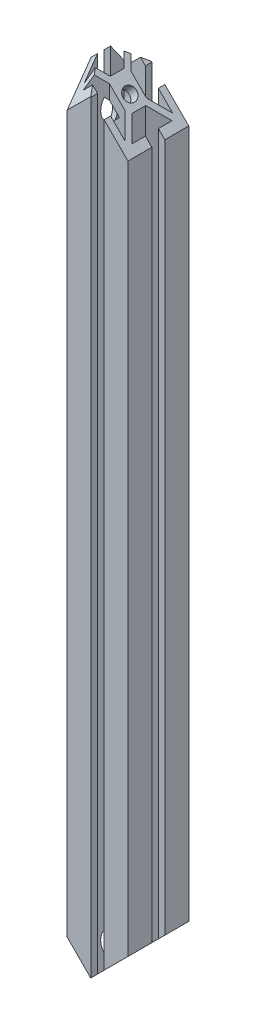
from build123d import *

# Parameters (mm, degrees)
EXTRUDE1_DEPTH       = 508
EXTRUDE2_DEPTH       = 457.2
SKETCH6_R            = 4.1656
EXTRUDE5_DEPTH       = 500.656640854
SKETCH8_R            = 9.525
EXTRUDE7_DEPTH       = 44.45
EXTRUDE8_DEPTH       = 374.167192757
MIRROR7_COPY_1_DEPTH = 374.167192757


# Read off the part's stored shape, not the designer's step: 1515<1>
with BuildPart() as part:
    # Sketch1<2> → Extrude1 (new body)
    with BuildSketch(Plane(origin=(0, 0, 0), x_dir=(1, 0, 0), z_dir=(0, 1, 0))):
        Polygon((-6.7564, 4.364749804), (-6.7564, -4.364749804), (-14.986, -12.594349804), (-14.986, -4.064), (-19.05, -4.064), (-19.05, -19.05), (-4.064, -19.05), (-4.064, -14.986), (-13.067127258, -14.986), (-4.837527258, -6.7564), (4.837527258, -6.7564), (13.067127258, -14.986), (4.064, -14.986), (4.064, -19.05), (19.05, -19.05), (19.05, -4.064), (14.986, -4.064), (14.986, -12.594349804), (6.7564, -4.364749804), (6.7564, 4.364749804), (14.986, 12.594349804), (14.986, 4.064), (19.05, 4.064), (19.05, 19.05), (4.064, 19.05), (4.064, 14.986), (13.067127258, 14.986), (4.837527258, 6.7564), (-4.837527258, 6.7564), (-13.067127258, 14.986), (-4.064, 14.986), (-4.064, 19.05), (-19.05, 19.05), (-19.05, 4.064), (-14.986, 4.064), (-14.986, 12.594349804), align=None)
    extrude(amount=EXTRUDE1_DEPTH)

    # Sketch2 → Extrude2 (cut)
    with BuildSketch(Plane.XY.offset(19.05)):
        Polygon((-19.05, 508), (19.05, 508), (19.05, 469.9), align=None)
        Polygon((-19.05, 0), (19.05, 38.1), (19.05, 0), align=None)
    extrude(amount=-EXTRUDE2_DEPTH, mode=Mode.SUBTRACT)

    # Sketch6 → Extrude5 (cut, through all)
    with BuildSketch(Plane(origin=(-9.525, 9.525, 0), x_dir=(0, 0, -1), z_dir=(0.7071067811865436, -0.7071067811865515, 0))):
        with Locations(Location((0, 15.104615818, 0), (0, 0, 90))):
            Circle(SKETCH6_R)
    extrude5 = extrude(amount=-EXTRUDE5_DEPTH, mode=Mode.SUBTRACT)

    # Sketch8 → Extrude7 (cut)
    with BuildSketch(Plane(origin=(-45.446024484, 45.446024484, 0), x_dir=(0.7071067811865515, 0.7071067811865436, 0), z_dir=(0.7071067811865436, -0.7071067811865515, 0))):
        with Locations((15.104615818, 0)):
            Circle(SKETCH8_R)
    extrude7 = extrude(amount=EXTRUDE7_DEPTH, mode=Mode.SUBTRACT)

    # Mirror5: Extrude5, Extrude7 across plane
    add(extrude5.mirror(Plane.ZX.offset(254)), mode=Mode.SUBTRACT)
    add(extrude7.mirror(Plane.ZX.offset(254)), mode=Mode.SUBTRACT)

    # Sketch10 → Extrude8 (cut, through all)
    with BuildSketch(Plane(origin=(244.475, 244.475, 0), x_dir=(0, 0, -1), z_dir=(0.7071067811865436, 0.7071067811865515, 0))):
        Polygon((-19.05, 372.680629024), (-2.29695366, 372.680629024), (-2.29695366, 368.599481163), (-19.05, 351.846434823), align=None)
    extrude8 = extrude(amount=-EXTRUDE8_DEPTH, mode=Mode.SUBTRACT)

    # Mirror6: Extrude8 across plane
    add(extrude8.mirror(Plane.XY), mode=Mode.SUBTRACT)

    # Mirror7: Extrude8 across plane
    add(extrude8.mirror(Plane.ZX.offset(254)), mode=Mode.SUBTRACT)

    # Mirror7 copy 1 sketch → Mirror7 copy 1 (cut, through all)
    with BuildSketch(Plane(origin=(244.475, 263.525, 0), x_dir=(0, 0, 1), z_dir=(0.7071067811865436, -0.7071067811865515, 0))):
        Polygon((-19.05, 372.680629024), (-2.29695366, 372.680629024), (-2.29695366, 368.599481163), (-19.05, 351.846434823), align=None)
    extrude(amount=-MIRROR7_COPY_1_DEPTH, mode=Mode.SUBTRACT)


solid = part.part
